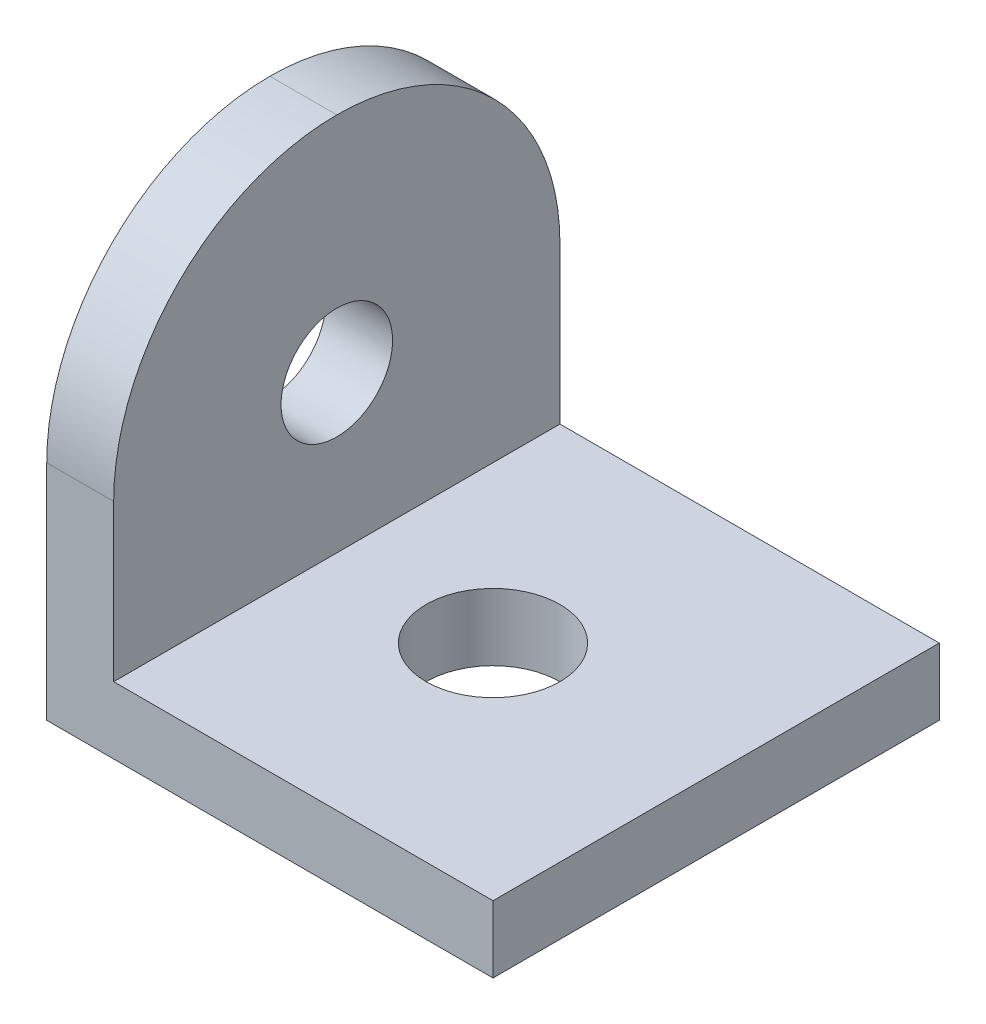
from build123d import *

# Parameters (mm, degrees)
SKETCH_1_W          = 20
SKETCH_1_H          = 20
EXTRUDE_1_DEPTH     = 20
SKETCH_2_W          = 17
SKETCH_2_H          = 17
CUT_EXTRUDE_1_DEPTH = 20
FILLET_1_R          = 10
SKETCH_3_R          = 2.5
CUT_EXTRUDE_2_DEPTH = 20
SKETCH_4_R          = 3
CUT_EXTRUDE_3_DEPTH = 20


with BuildPart() as part:
    # 草图1 → 凸台-拉伸1 (new body)
    with BuildSketch(Plane(origin=(0, 0, 0), x_dir=(1, 0, 0), z_dir=(0, 1, 0))):
        Rectangle(SKETCH_1_W, SKETCH_1_H)
    extrude(amount=EXTRUDE_1_DEPTH)

    # 草图2 → 切除-拉伸1 (cut)
    with BuildSketch(Plane.XY.offset(10)):
        with Locations((1.5, 11.5)):
            Rectangle(SKETCH_2_W, SKETCH_2_H)
    extrude(amount=-CUT_EXTRUDE_1_DEPTH, mode=Mode.SUBTRACT)

    # 圆角1
    fillet_1_edges = [part.edges().sort_by_distance(p)[0] for p in [
        (-8.5, 20, -10),
        (-8.5, 20, 10),
    ]]
    fillet(fillet_1_edges, radius=FILLET_1_R - 0.0001)  # a hair under: the kernel refuses the full size

    # 草图3 → 切除-拉伸2 (cut)
    with BuildSketch(Plane(origin=(-7, 0, 0), x_dir=(0, 0, -1), z_dir=(1, 0, 0))):
        with Locations((0, 10)):
            Circle(SKETCH_3_R)
    extrude(amount=-CUT_EXTRUDE_2_DEPTH, mode=Mode.SUBTRACT)

    # 草图4 → 切除-拉伸3 (cut)
    with BuildSketch(Plane(origin=(0, 3, 0), x_dir=(1, 0, 0), z_dir=(0, 1, 0))):
        with Locations(Location((0, 0, 0), (0, 0, 270))):
            Circle(SKETCH_4_R)
    extrude(amount=-CUT_EXTRUDE_3_DEPTH, mode=Mode.SUBTRACT)


solid = part.part
